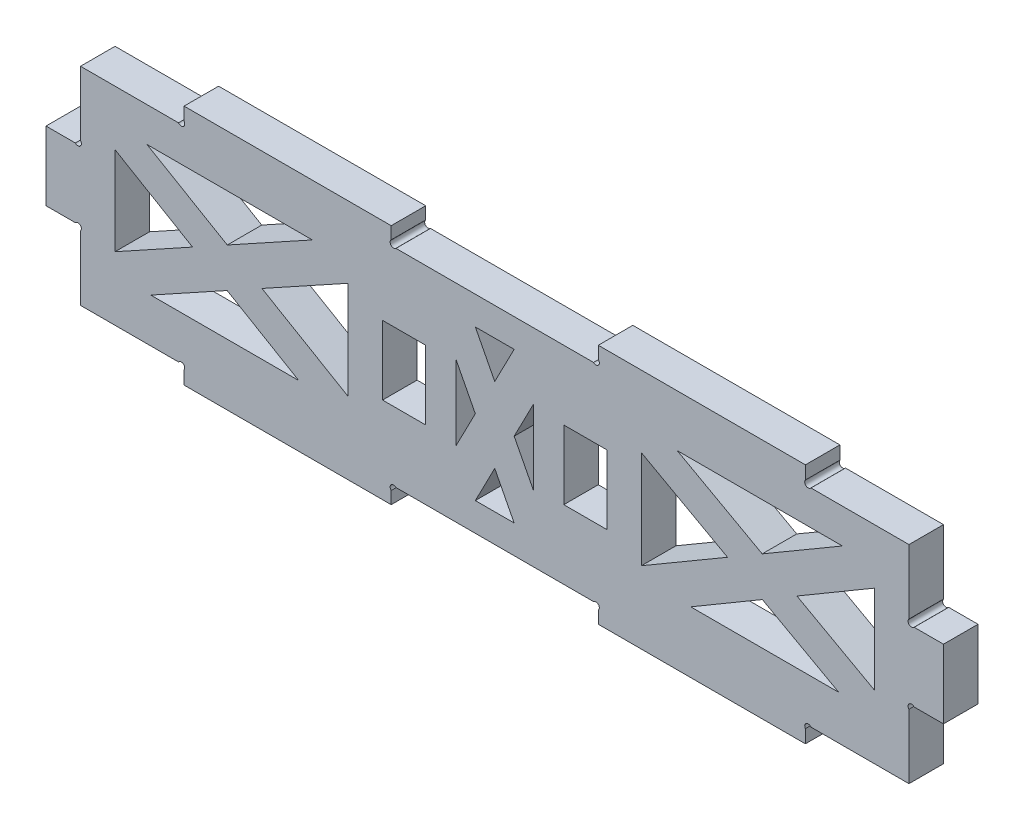
from build123d import *

# Parameters (mm, degrees)
SKETCH1_W           = 330.2
SKETCH1_H           = 76.2
BOSS_EXTRUDE1_DEPTH = 12.7
SKETCH2_W           = 76.2
SKETCH2_H           = 6.35
BOSS_EXTRUDE2_DEPTH = 12.7
SKETCH3_W           = 12.7
SKETCH3_H           = 25.4
SKETCH3_W_2         = 15.875
CUT_EXTRUDE1_DEPTH  = 172.45
CUT_EXTRUDE2_DEPTH  = 172.45
SKETCH7_R           = 1.27
CUT_EXTRUDE4_DEPTH  = 172.45


with BuildPart() as part:
    # Sketch1 → Boss-Extrude1 (new body)
    with BuildSketch(Plane.XY):
        Rectangle(SKETCH1_W, SKETCH1_H)
    extrude(amount=BOSS_EXTRUDE1_DEPTH)

    # Sketch2 → Boss-Extrude2 (add)
    with BuildSketch(Plane.XY.offset(12.7)):
        with Locations((-76.2, -41.275)):
            Rectangle(SKETCH2_W, SKETCH2_H)
        with Locations((76.2, -41.275)):
            Rectangle(SKETCH2_W, SKETCH2_H)
        with Locations((76.2, 41.275)):
            Rectangle(SKETCH2_W, SKETCH2_H)
        with Locations((-76.2, 41.275)):
            Rectangle(SKETCH2_W, SKETCH2_H)
    extrude(amount=-BOSS_EXTRUDE2_DEPTH)

    # Sketch3 → Cut-Extrude1 (cut, through all)
    with BuildSketch(Plane.XY.offset(12.7)):
        with Locations((-158.75, -25.4)):
            Rectangle(SKETCH3_W, SKETCH3_H)
        with Locations((-158.75, 25.4)):
            Rectangle(SKETCH3_W, SKETCH3_H)
        with Locations((158.75, 25.4)):
            Rectangle(SKETCH3_W, SKETCH3_H)
        with Locations((158.75, -25.4)):
            Rectangle(SKETCH3_W, SKETCH3_H)
        with Locations((33.3375, 0)):
            Rectangle(SKETCH3_W_2, SKETCH3_H)
        with Locations((-33.3375, 0)):
            Rectangle(SKETCH3_W_2, SKETCH3_H)
    extrude(amount=-CUT_EXTRUDE1_DEPTH, mode=Mode.SUBTRACT)

    # Sketch4 → Cut-Extrude2 (cut, through all)
    with BuildSketch(Plane.XY.offset(12.7)):
        Polygon((-98.459533988, -6.395545943), (-126.555106965, -21.896551724), (-72.104902526, -21.896551724), align=None)
        Polygon((-139.7, 17.860862384), (-139.7, -14.644196946), (-111.184144119, 1.088689057), align=None)
        Polygon((-85.651314146, 0.671058107), (-53.975, -17.860862384), (-53.975, 18.147645222), align=None)
        Polygon((-67.119893035, 25.4), (-127.920097474, 25.4), (-98.410958103, 8.1359641), align=None)
        Polygon((53.975, -17.860862384), (85.651314146, 0.671058107), (53.975, 18.147645222), align=None)
        Polygon((98.459533988, -6.395545943), (72.104902526, -21.896551724), (126.555106965, -21.896551724), align=None)
        Polygon((127.920097474, 25.4), (67.119893035, 25.4), (98.410958103, 8.1359641), align=None)
        Polygon((111.184144119, 1.088689057), (139.7, -14.644196946), (139.7, 17.860862384), align=None)
        Polygon((-7.146832451, 0), (-14.2875, 13.826526955), (-14.2875, -13.826526955), align=None)
        Polygon((7.140667549, -27.664991055), (0, -13.8384641), (-7.140667549, -27.664991055), align=None)
        Polygon((-7.140667549, 27.664991055), (0, 13.8384641), (7.140667549, 27.664991055), align=None)
        Polygon((14.2875, 13.826526955), (7.146832451, 0), (14.2875, -13.826526955), align=None)
    extrude(amount=-CUT_EXTRUDE2_DEPTH, mode=Mode.SUBTRACT)

    # Sketch7 → Cut-Extrude4 (cut, through all)
    with BuildSketch(Plane.XY.offset(12.7)):
        with Locations((-153.357161978, -13.534710098)):
            Circle(SKETCH7_R)
        with Locations((-115.322216931, -38.853639533)):
            Circle(SKETCH7_R)
        with Locations((-37.219883345, -39.015584335)):
            Circle(SKETCH7_R)
        with Locations((37.219883345, -39.015584335)):
            Circle(SKETCH7_R)
        with Locations((115.322216931, -38.853639533)):
            Circle(SKETCH7_R)
        with Locations((153.357161978, -13.534710098)):
            Circle(SKETCH7_R)
        with Locations((153.357161978, 13.534710098)):
            Circle(SKETCH7_R)
        with Locations((115.322216931, 38.853639533)):
            Circle(SKETCH7_R)
        with Locations((37.219883345, 39.015584335)):
            Circle(SKETCH7_R)
        with Locations((-37.219883345, 39.015584335)):
            Circle(SKETCH7_R)
        with Locations((-115.322216931, 38.853639533)):
            Circle(SKETCH7_R)
        with Locations((-153.357161978, 13.534710098)):
            Circle(SKETCH7_R)
    extrude(amount=-CUT_EXTRUDE4_DEPTH, mode=Mode.SUBTRACT)


solid = part.part
